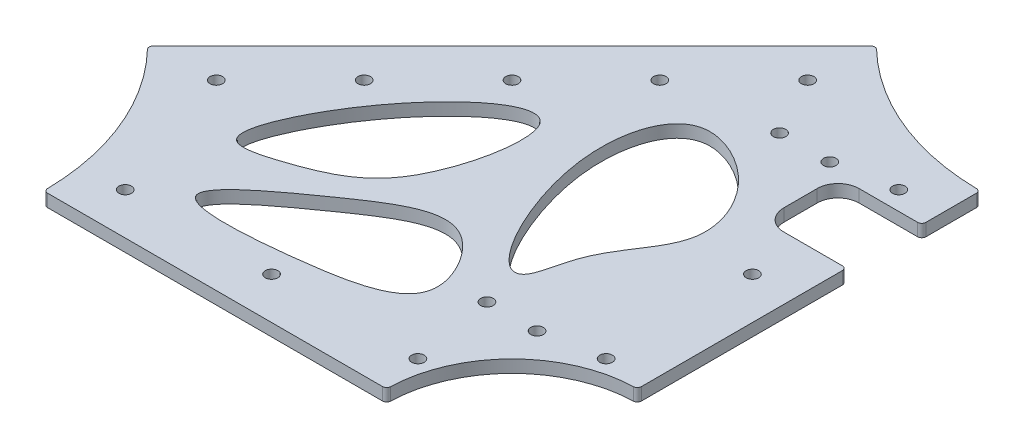
from build123d import *

# Parameters (mm, degrees)
EXTRUDE_1_DEPTH     = 3
SKETCH_2_R          = 60
SKETCH_2_R_2        = 30
CUT_EXTRUDE_1_DEPTH = 220.390691703
SKETCH_3_R          = 1.5
CUT_EXTRUDE_2_DEPTH = 191.220260404
SKETCH_4_W          = 20
SKETCH_4_H          = 18
CUT_EXTRUDE_3_DEPTH = 191.220260404
FILLET_1_R          = 5
CUT_EXTRUDE_START   = -3
CUT_EXTRUDE_4_DEPTH = 3
FILLET_2_R          = 1


# Read off the part's stored shape, not the designer's step: 切除-拉伸4
with BuildPart() as part:
    # 草图1 → 凸台-拉伸1 (new body)
    with BuildSketch(Plane(origin=(0, 0, 0), x_dir=(1, 0, 0), z_dir=(0, 1, 0))):
        Polygon((147.885822331, -10), (147.885822331, 162.027957955), (-24.142135624, -10), align=None)
    extrude(amount=EXTRUDE_1_DEPTH)

    # 草图2 → 切除-拉伸1 (cut, through all)
    with BuildSketch(Plane(origin=(0, 3, 0), x_dir=(1, 0, 0), z_dir=(0, 1, 0))):
        with Locations((147.885822331, 162.027957955)):
            Circle(SKETCH_2_R)
        with Locations((-24.142135624, -10)):
            Circle(SKETCH_2_R)
        with Locations((147.885822331, -10)):
            Circle(SKETCH_2_R_2)
    extrude(amount=-CUT_EXTRUDE_1_DEPTH, mode=Mode.SUBTRACT)

    # 草图3 → 切除-拉伸2 (cut, through all)
    with BuildSketch(Plane(origin=(0, 3, 0), x_dir=(1, 0, 0), z_dir=(0, 1, 0))):
        with Locations(Location((115.385822331, 0, 0), (0, 0, 270))):
            Circle(SKETCH_3_R)
        with Locations(Location((80.385822331, 0, 0), (0, 0, 270))):
            Circle(SKETCH_3_R)
        with Locations(Location((45.385822331, 0, 0), (0, 0, 270))):
            Circle(SKETCH_3_R)
        with Locations(Location((33.587572106, 33.587572106, 0), (0, 0, 270))):
            Circle(SKETCH_3_R)
        with Locations(Location((51.265241636, 51.265241636, 0), (0, 0, 270))):
            Circle(SKETCH_3_R)
        with Locations(Location((68.942911166, 68.942911166, 0), (0, 0, 270))):
            Circle(SKETCH_3_R)
        with Locations(Location((86.620580695, 86.620580695, 0), (0, 0, 270))):
            Circle(SKETCH_3_R)
        with Locations(Location((104.298250225, 104.298250225, 0), (0, 0, 270))):
            Circle(SKETCH_3_R)
        with Locations(Location((137.885822331, 22.5, 0), (0, 0, 90))):
            Circle(SKETCH_3_R)
        with Locations(Location((137.885822331, 57.5, 0), (0, 0, 90))):
            Circle(SKETCH_3_R)
        with Locations(Location((137.885822331, 92.5, 0), (0, 0, 90))):
            Circle(SKETCH_3_R)
        with Locations(Location((111.885822331, 90, 0), (0, 0, 270))):
            Circle(SKETCH_3_R)
        with Locations(Location((111.885822331, 20, 0), (0, 0, 270))):
            Circle(SKETCH_3_R)
        with Locations(Location((123.885822331, 90, 0), (0, 0, 90))):
            Circle(SKETCH_3_R)
        with Locations(Location((123.885822331, 20, 0), (0, 0, 90))):
            Circle(SKETCH_3_R)
    extrude(amount=-CUT_EXTRUDE_2_DEPTH, mode=Mode.SUBTRACT)

    # 草图4 → 切除-拉伸3 (cut, through all)
    with BuildSketch(Plane(origin=(0, 3, 0), x_dir=(1, 0, 0), z_dir=(0, 1, 0))):
        with Locations((137.885822331, 79)):
            Rectangle(SKETCH_4_W, SKETCH_4_H)
    extrude(amount=-CUT_EXTRUDE_3_DEPTH, mode=Mode.SUBTRACT)

    # 圆角1
    fillet_1_edges = [part.edges().sort_by_distance(p)[0] for p in [
        (127.885822331, 1.5, -70),
        (127.885822331, 1.5, -88),
    ]]
    fillet(fillet_1_edges, radius=FILLET_1_R)

    # 切除-拉伸4 outline → 切除-拉伸4 (cut)
    with BuildSketch(Plane(origin=(0, 3, 0), x_dir=(1, 0, 0), z_dir=(0, 1, 0)).offset(CUT_EXTRUDE_START)):
        with BuildLine():
            add(Edge.make_bspline(
                [(50.5747885, 35.349413139), (48.134913422, 30.232146409), (45.066316723, 20.609429713), (64.275981259, 26.151145773), (79.457511235, 33.799446388), (88.250297614, 80.745218058), (58.984602869, 52.987719157), (50.5747885, 35.349413139)],
                knots=[0, 0, 0, 0, 0.107328916, 0.199210103, 0.390221811, 0.630056365, 1, 1, 1, 1], degree=3))
        make_face()
        with BuildLine():
            add(Edge.make_bspline(
                [(72.165417057, 23.631211719), (63.691109654, 17.706672606), (43.742296227, 3.192166655), (81.270063611, 5.49770819), (109.00266126, 11.111657915), (93.531743282, 38.108363778), (80.717249614, 29.609950047), (72.165417057, 23.631211719)],
                knots=[0, 0, 0, 0, 0.206793074, 0.4382452, 0.647934213, 0.79131513, 1, 1, 1, 1], degree=3))
        make_face()
        with BuildLine():
            add(Edge.make_bspline(
                [(101.34923684, 81.740455866), (95.121470027, 80.262390997), (88.497121545, 57.218340709), (110.267282535, 18.617806799), (113.854872687, 45.05421857), (127.45428515, 56.666904931), (118.879313975, 76.871558074), (105.626528502, 82.755605394), (101.34923684, 81.740455866)],
                knots=[0, 0, 0, 0, 0.186987122, 0.466255407, 0.546491429, 0.714519684, 0.8715754, 1, 1, 1, 1], degree=3))
        make_face()
    extrude(amount=CUT_EXTRUDE_4_DEPTH, mode=Mode.SUBTRACT)

    # 圆角2
    fillet_2_edges = [part.edges().sort_by_distance(p)[0] for p in [
        (147.885822331, 1.5, -88),
        (147.885822331, 1.5, -70),
        (147.885822331, 1.5, -102.027957955),
        (105.45941546, 1.5, -119.601551084),
        (35.857864376, 1.5, 10),
        (18.284271247, 1.5, -32.426406871),
        (117.885822331, 1.5, 10),
        (147.885822331, 1.5, -20),
    ]]
    fillet(fillet_2_edges, radius=FILLET_2_R)


solid = part.part
